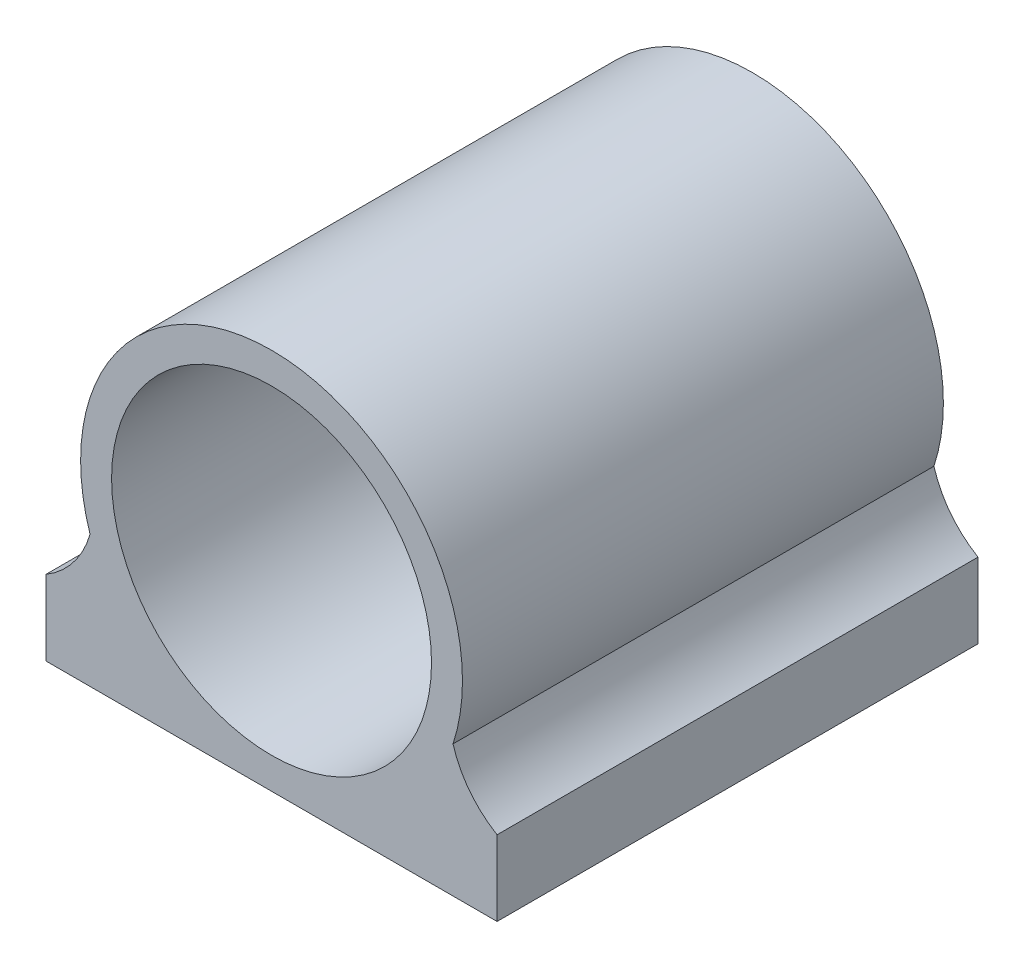
from build123d import *

# Parameters (mm, degrees)
SKETCH1_R           = 18.5
SKETCH1_R_2         = 15.5
BOSS_EXTRUDE1_DEPTH = 46.6
SKETCH4_W           = 43.709561032
SKETCH4_H           = 12.768078571
BOSS_EXTRUDE2_DEPTH = 46.6
SKETCH5_R           = 15.5
CUT_EXTRUDE1_DEPTH  = 55.698893074
CUT_EXTRUDE4_DEPTH  = 46.6


# Read off the part's stored shape, not the designer's step: Cut-Extrude4
with BuildPart() as part:
    # Sketch1 → Boss-Extrude1 (new body)
    with BuildSketch(Plane.XY):
        Circle(SKETCH1_R)
        Circle(SKETCH1_R_2, mode=Mode.SUBTRACT)
    extrude(amount=BOSS_EXTRUDE1_DEPTH)

    # Sketch4 → Boss-Extrude2 (add, through all)
    with BuildSketch(Plane.XY):
        with Locations((0, -12.13021123)):
            Rectangle(SKETCH4_W, SKETCH4_H)
    extrude(amount=BOSS_EXTRUDE2_DEPTH)

    # Sketch5 → Cut-Extrude1 (cut, through all)
    with BuildSketch(Plane.XY):
        Circle(SKETCH5_R)
    extrude(amount=CUT_EXTRUDE1_DEPTH, mode=Mode.SUBTRACT)

    # Cut-Extrude4 outline → Cut-Extrude4 (cut)
    with BuildSketch(Plane.XY):
        with BuildLine():
            ThreePointArc((-21.854780516, -11.237165736), (-19.197353427, -8.897985946), (-17.584979613, -5.746171944))
            Line((-17.584979613, -5.746171944), (-21.854780516, -5.746171944))
            Line((-21.854780516, -5.746171944), (-21.854780516, -11.237165736))
        make_face()
    cut_extrude4 = extrude(amount=CUT_EXTRUDE4_DEPTH, mode=Mode.SUBTRACT)

    # Mirror2: Cut-Extrude4 across plane
    add(cut_extrude4.mirror(Plane(origin=(0, 0, 0), x_dir=(0, 0, 1), z_dir=(1, 0, 0))), mode=Mode.SUBTRACT)


solid = part.part
